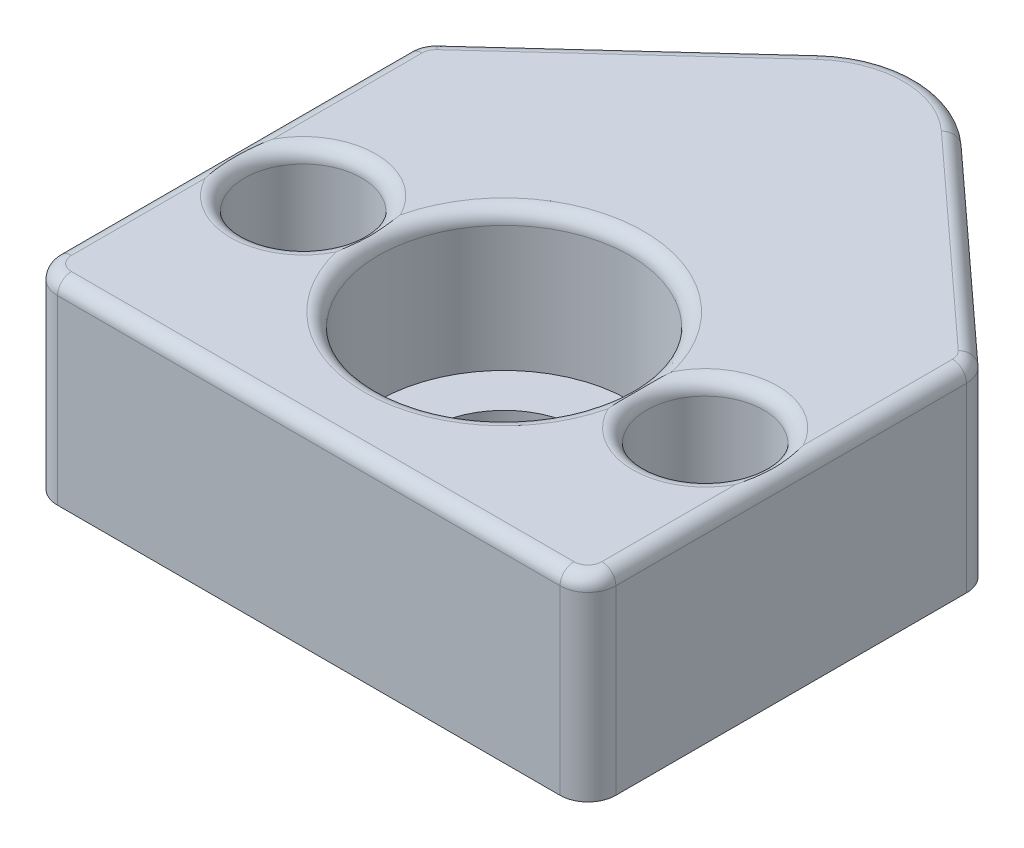
from build123d import *

# Parameters (mm, degrees)
SKETCH_1_W          = 20
SKETCH_1_H          = 14
SKETCH_1_R          = 2.75
SKETCH_1_R_2        = 3.8
SKETCH_1_R_3        = 2.6
EXTRUDE_1_DEPTH     = 7
CUT_EXTRUDE_START   = -5
SKETCH_2_R          = 4.5
SKETCH_2_R_2        = 2.75
CUT_EXTRUDE_1_DEPTH = 5
SKETCH_8_R          = 1.25
CUT_EXTRUDE_3_DEPTH = 20.184368637
SKETCH_9_R          = 2.1
SKETCH_9_R_2        = 1.25
CUT_EXTRUDE_4_DEPTH = 6
EXTRUDE_START       = -4
EXTRUDE_2_DEPTH     = 4
SKETCH_11_W         = 1.5
SKETCH_11_H         = 4.7
EXTRUDE_3_DEPTH     = 1
CUT_EXTRUDE_5_DEPTH = 2
CUT_EXTRUDE_6_DEPTH = 1
FILLET_1_R          = 1
FILLET_2_R          = 0.5


with BuildPart() as part:
    # Эскиз1 → Бобышка-Вытянуть1 (new body)
    # profile 1 of 5: a face of its own
    with BuildSketch(Plane(origin=(0, 0, 0), x_dir=(1, 0, 0), z_dir=(0, 1, 0))):
        Rectangle(SKETCH_1_W, SKETCH_1_H)
        with Locations(Location((0, 0, 0), (0, 0, 270))):
            Circle(SKETCH_1_R, mode=Mode.SUBTRACT)
    # profile 2 of 5: a face of its own
    with BuildSketch(Plane(origin=(0, 0, 0), x_dir=(1, 0, 0), z_dir=(0, 1, 0))):
        with BuildLine():
            Line((-2.565353551, 13.803383877), (-10, 7))
            Line((-10, 7), (10, 7))
            Line((10, 7), (2.565353551, 13.803383877))
            ThreePointArc((2.565353551, 13.803383877), (3.477667573, 12.531609694), (3.8, 11))
            ThreePointArc((3.8, 11), (-1.531609694, 7.522332427), (-2.565353551, 13.803383877))
        make_face()
    # profile 3 of 5: a face of its own
    with BuildSketch(Plane(origin=(0, 0, 0), x_dir=(1, 0, 0), z_dir=(0, 1, 0))):
        with Locations((0, 11)):
            Circle(SKETCH_1_R_2)
        with Locations((0, 11)):
            Circle(SKETCH_1_R_3, mode=Mode.SUBTRACT)
    # profile 4 of 5: a face of its own
    with BuildSketch(Plane(origin=(0, 0, 0), x_dir=(1, 0, 0), z_dir=(0, 1, 0))):
        with BuildLine():
            ThreePointArc((1.112429773, 13.35), (0, 13.6), (-1.112429773, 13.35))
            Line((-1.112429773, 13.35), (1.112429773, 13.35))
        make_face()
    # profile 5 of 5: a face of its own
    with BuildSketch(Plane(origin=(0, 0, 0), x_dir=(1, 0, 0), z_dir=(0, 1, 0))):
        with BuildLine():
            Line((1.112429773, 8.65), (-1.112429773, 8.65))
            ThreePointArc((-1.112429773, 8.65), (0, 8.4), (1.112429773, 8.65))
        make_face()
    extrude(amount=EXTRUDE_1_DEPTH)

    # Эскиз2 → Вырез-Вытянуть1 (cut)
    with BuildSketch(Plane(origin=(0, 7, 0), x_dir=(1, 0, 0), z_dir=(0, 1, 0)).offset(CUT_EXTRUDE_START)):
        with Locations(Location((0, 0, 0), (0, 0, 270))):
            Circle(SKETCH_2_R)
        with Locations(Location((0, 0, 0), (0, 0, 270))):
            Circle(SKETCH_2_R_2, mode=Mode.SUBTRACT)
    extrude(amount=CUT_EXTRUDE_1_DEPTH, mode=Mode.SUBTRACT)

    # Эскиз8 → Вырез-Вытянуть3 (cut, through all)
    with BuildSketch(Plane(origin=(0, 7, 0), x_dir=(1, 0, 0), z_dir=(0, 1, 0))):
        with Locations(Location((7.2, 0, 0), (0, 0, 270))):
            Circle(SKETCH_8_R)
        with Locations(Location((-7.2, 0, 0), (0, 0, 90))):
            Circle(SKETCH_8_R)
    extrude(amount=-CUT_EXTRUDE_3_DEPTH, mode=Mode.SUBTRACT)

    # Эскиз9 → Вырез-Вытянуть4 (cut)
    # profile 1 of 2: a face of its own
    with BuildSketch(Plane(origin=(0, 7, 0), x_dir=(1, 0, 0), z_dir=(0, 1, 0))):
        with Locations(Location((-7.2, 0, 0), (0, 0, 270))):
            Circle(SKETCH_9_R)
        with Locations(Location((-7.2, 0, 0), (0, 0, 270))):
            Circle(SKETCH_9_R_2, mode=Mode.SUBTRACT)
    # profile 2 of 2: a face of its own
    with BuildSketch(Plane(origin=(0, 7, 0), x_dir=(1, 0, 0), z_dir=(0, 1, 0))):
        with Locations(Location((7.2, 0, 0), (0, 0, 270))):
            Circle(SKETCH_9_R)
        with Locations(Location((7.2, 0, 0), (0, 0, 270))):
            Circle(SKETCH_9_R_2, mode=Mode.SUBTRACT)
    extrude(amount=-CUT_EXTRUDE_4_DEPTH, mode=Mode.SUBTRACT)

    # Эскиз10 → Бобышка-Вытянуть2 (add)
    with BuildSketch(Plane(origin=(0, 7, 0), x_dir=(1, 0, 0), z_dir=(0, 1, 0)).offset(EXTRUDE_START)):
        with BuildLine():
            ThreePointArc((1.112429773, 13.35), (2.6, 11), (1.112429773, 8.65))
            Line((1.112429773, 8.65), (-1.112429773, 8.65))
            ThreePointArc((-1.112429773, 8.65), (-2.6, 11), (-1.112429773, 13.35))
            Line((-1.112429773, 13.35), (1.112429773, 13.35))
        make_face()
    extrude(amount=EXTRUDE_2_DEPTH)

    # Эскиз11 → Бобышка-Вытянуть3 (add)
    with BuildSketch(Plane.XZ.offset(-3)):
        with Locations((0, -11)):
            Rectangle(SKETCH_11_W, SKETCH_11_H)
    extrude(amount=EXTRUDE_3_DEPTH)

    # Эскиз12 → Вырез-Вытянуть5 (cut)
    with BuildSketch(Plane.XZ):
        Polygon((-2, -5.5), (-2, -8.65), (-1.112429773, -8.65), (1.112429773, -8.65), (2, -8.65), (2, -5.5), align=None)
        with BuildLine():
            Line((-1.112429773, -8.65), (-2, -8.65))
            Line((-2, -8.65), (-2, -9.338675227))
            ThreePointArc((-2, -9.338675227), (-1.593854813, -8.945826971), (-1.112429773, -8.65))
        make_face()
        with BuildLine():
            Line((2, -8.65), (1.112429773, -8.65))
            ThreePointArc((1.112429773, -8.65), (1.593854813, -8.945826971), (2, -9.338675227))
            Line((2, -9.338675227), (2, -8.65))
        make_face()
    extrude(amount=-CUT_EXTRUDE_5_DEPTH, mode=Mode.SUBTRACT)

    # Эскиз13 → Вырез-Вытянуть6 (cut)
    with BuildSketch(Plane.XZ.offset(-2)):
        with BuildLine():
            Line((2, -5.5), (0.75, -5.5))
            Line((0.75, -5.5), (0.75, -8.65))
            Line((0.75, -8.65), (1.112429773, -8.65))
            ThreePointArc((1.112429773, -8.65), (1.593854813, -8.945826971), (2, -9.338675227))
            Line((2, -9.338675227), (2, -5.5))
        make_face()
        with BuildLine():
            Line((-1.112429773, -8.65), (-0.75, -8.65))
            Line((-0.75, -8.65), (-0.75, -5.5))
            Line((-0.75, -5.5), (-2, -5.5))
            Line((-2, -5.5), (-2, -9.338675227))
            ThreePointArc((-2, -9.338675227), (-1.593854813, -8.945826971), (-1.112429773, -8.65))
        make_face()
    extrude(amount=-CUT_EXTRUDE_6_DEPTH, mode=Mode.SUBTRACT)

    # Скругление1
    fillet_1_edges = [part.edges().sort_by_distance(p)[0] for p in [
        (-10, 3.5, 7),
        (-10, 3.5, -7),
        (10, 3.5, -7),
        (10, 3.5, 7),
    ]]
    fillet(fillet_1_edges, radius=FILLET_1_R)

    # Скругление2
    # the kernel refuses this fillet: 0.5 mm, written as the material it takes off along each edge
    with BuildSketch(Plane(origin=(-10, 7, -6.559587091), x_dir=(1, 0, 0), z_dir=(0, 0, 1)), Plane(origin=(10, 7, 6), x_dir=(-1, 0, 0), z_dir=(0, 0, -1))) as fillet_2_piece_1:
        with BuildLine():
            CenterArc((FILLET_2_R, -FILLET_2_R), FILLET_2_R, 90, 90)
            Line((0, -FILLET_2_R), (0, 0))
            Line((0, 0), (FILLET_2_R, 0))
        make_face()
    extrude(amount=12.559587091, mode=Mode.SUBTRACT)
    with BuildSketch(Plane(origin=(-2.565353551, 7, -13.803383877), x_dir=(0.6750930396508724, 0, 0.7377325991271809), z_dir=(-0.7377325991271809, 0, 0.6750930396508723)), Plane(origin=(9.67509304, 7, -7.29731969), x_dir=(-0.6750930396508725, 0, 0.7377325991271807), z_dir=(-0.7377325991271807, 0, -0.6750930396508726))) as fillet_2_piece_2:
        with BuildLine():
            CenterArc((FILLET_2_R, -FILLET_2_R), FILLET_2_R, 90, 90)
            Line((0, -FILLET_2_R), (0, 0))
            Line((0, 0), (FILLET_2_R, 0))
        make_face()
    extrude(amount=9.63728524, mode=Mode.SUBTRACT)
    with BuildSketch(Plane(origin=(-9, 7, 7), x_dir=(0, -1, 0), z_dir=(1, 0, 0))) as fillet_2_piece_3:
        with BuildLine():
            CenterArc((FILLET_2_R, FILLET_2_R), FILLET_2_R, 180, 90)
            Line((0, FILLET_2_R), (0, 0))
            Line((0, 0), (FILLET_2_R, 0))
        make_face()
    extrude(amount=18, mode=Mode.SUBTRACT)
    with BuildSketch(Plane(origin=(9, 7, -6.559587091), x_dir=(0.6750930396508728, 0, -0.7377325991271806), z_dir=(-0.7377325991271806, 0, -0.6750930396508728))) as fillet_2_piece_4:
        with BuildLine():
            CenterArc((1 - FILLET_2_R, FILLET_2_R), FILLET_2_R, 270, 90)
            Line((1, FILLET_2_R), (1, 0))
            Line((1, 0), (1 - FILLET_2_R, 0))
        make_face()
    revolve(axis=Axis((9, 7, -6.559587091), (0, -1, 0)), revolution_arc=47.538624316, mode=Mode.SUBTRACT)
    with BuildSketch(Plane(origin=(9, 7, 6), x_dir=(0, 0, 1), z_dir=(-1, 0, 0))) as fillet_2_piece_5:
        with BuildLine():
            CenterArc((1 - FILLET_2_R, -FILLET_2_R), FILLET_2_R, 0, 90)
            Line((1 - FILLET_2_R, 0), (1, 0))
            Line((1, 0), (1, -FILLET_2_R))
        make_face()
    revolve(axis=Axis((9, 7, 6), (0, 1, 0)), revolution_arc=90, mode=Mode.SUBTRACT)
    with BuildSketch(Plane(origin=(-9, 7, 6), x_dir=(0, 0, 1), z_dir=(1, 0, 0))) as fillet_2_piece_6:
        with BuildLine():
            CenterArc((1 - FILLET_2_R, FILLET_2_R), FILLET_2_R, 270, 90)
            Line((1 - FILLET_2_R, 0), (1, 0))
            Line((1, 0), (1, FILLET_2_R))
        make_face()
    revolve(axis=Axis((-9, 7, 6), (0, -1, 0)), revolution_arc=90, mode=Mode.SUBTRACT)
    with BuildSketch(Plane(origin=(-9, 7, -6.559587091), x_dir=(-0.6750930396508718, 0, -0.7377325991271815), z_dir=(0.7377325991271815, 0, -0.6750930396508718))) as fillet_2_piece_7:
        with BuildLine():
            CenterArc((1 - FILLET_2_R, -FILLET_2_R), FILLET_2_R, 0, 90)
            Line((1, -FILLET_2_R), (1, 0))
            Line((1, 0), (1 - FILLET_2_R, 0))
        make_face()
    revolve(axis=Axis((-9, 7, -6.559587091), (0, 1, 0)), revolution_arc=47.538624316, mode=Mode.SUBTRACT)
    with BuildSketch(Plane(origin=(0, 7, -11), x_dir=(0.6750930396508724, 0, -0.7377325991271808), z_dir=(0.7377325991271808, 0, 0.6750930396508724))) as fillet_2_piece_8:
        with BuildLine():
            CenterArc((3.8 - FILLET_2_R, -FILLET_2_R), FILLET_2_R, 0, 90)
            Line((3.8, -FILLET_2_R), (3.8, 0))
            Line((3.8, 0), (3.8 - FILLET_2_R, 0))
        make_face()
    revolve(axis=Axis((0, 7, -11), (0, 1, 0)), revolution_arc=84.922751368, mode=Mode.SUBTRACT)
    with BuildSketch(Plane(origin=(0, 7, 0), x_dir=(0, 0, 1), z_dir=(-1, 0, 0))) as fillet_2_piece_9:
        with BuildLine():
            CenterArc((4.5 + FILLET_2_R, -FILLET_2_R), FILLET_2_R, 90, 90)
            Line((4.5, -FILLET_2_R), (4.5, 0))
            Line((4.5, 0), (4.5 + FILLET_2_R, 0))
        make_face()
    revolve(axis=Axis((0, 7, 0), (0, 1, 0)), mode=Mode.SUBTRACT)
    with BuildSketch(Plane(origin=(-7.2, 7, 0), x_dir=(0, 0, 1), z_dir=(-1, 0, 0))) as fillet_2_piece_10:
        with BuildLine():
            CenterArc((2.1 + FILLET_2_R, -FILLET_2_R), FILLET_2_R, 90, 90)
            Line((2.1, -FILLET_2_R), (2.1, 0))
            Line((2.1, 0), (2.1 + FILLET_2_R, 0))
        make_face()
    revolve(axis=Axis((-7.2, 7, 0), (0, 1, 0)), mode=Mode.SUBTRACT)
    with BuildSketch(Plane(origin=(7.2, 7, 0), x_dir=(0, 0, 1), z_dir=(-1, 0, 0))) as fillet_2_piece_11:
        with BuildLine():
            CenterArc((2.1 + FILLET_2_R, -FILLET_2_R), FILLET_2_R, 90, 90)
            Line((2.1, -FILLET_2_R), (2.1, 0))
            Line((2.1, 0), (2.1 + FILLET_2_R, 0))
        make_face()
    revolve(axis=Axis((7.2, 7, 0), (0, 1, 0)), mode=Mode.SUBTRACT)


solid = part.part
